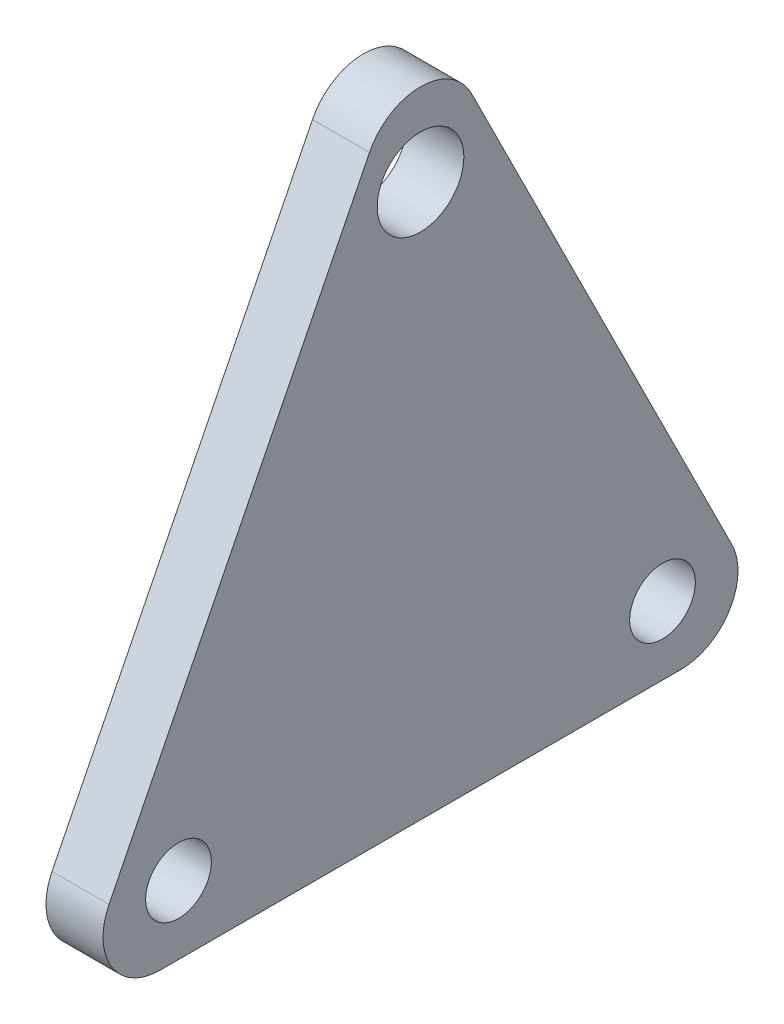
from build123d import *

# Parameters (mm, degrees)
SKETCH1_R           = 1.8288
SKETCH1_R_2         = 2.413
BOSS_EXTRUDE1_DEPTH = 3.175
FILLET1_R           = 3.175


with BuildPart() as part:
    # Sketch1 → Boss-Extrude1 (new body)
    with BuildSketch(Plane(origin=(0, 0, 0), x_dir=(0, 0, -1), z_dir=(1, 0, 0))):
        Polygon((19.639409497, -3.81), (-19.639409497, -3.81), (0, 35.468818994), align=None)
        with Locations((-13.4747, 0)):
            Circle(SKETCH1_R, mode=Mode.SUBTRACT)
        with Locations((0, 26.9494)):
            Circle(SKETCH1_R_2, mode=Mode.SUBTRACT)
        with Locations((13.4747, 0)):
            Circle(SKETCH1_R, mode=Mode.SUBTRACT)
    extrude(amount=BOSS_EXTRUDE1_DEPTH)

    # Fillet1
    fillet1_edges = [part.edges().sort_by_distance(p)[0] for p in [
        (1.5875, 35.468818994, 0),
        (1.5875, -3.81, -19.639409497),
        (1.5875, -3.81, 19.639409497),
    ]]
    fillet(fillet1_edges, radius=FILLET1_R)


solid = part.part
